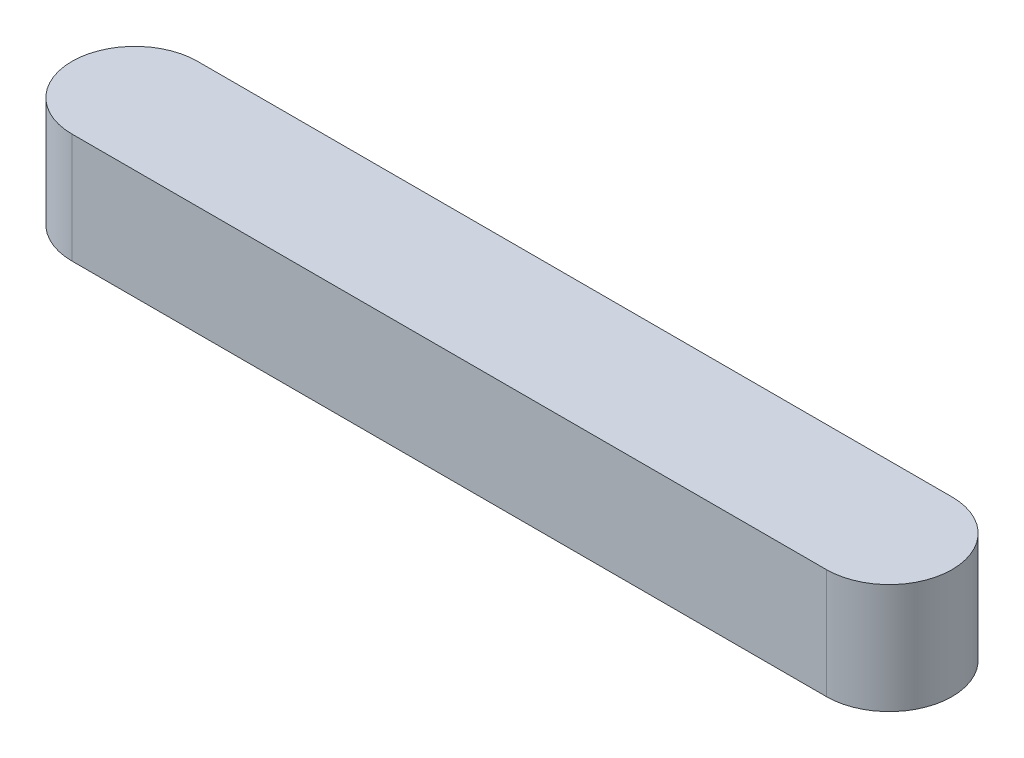
from build123d import *

# Parameters (mm, degrees)
EXTRUDE_1_DEPTH = 7


with BuildPart() as part:
    # Эскиз1 → Бобышка-Вытянуть1 (new body)
    with BuildSketch(Plane(origin=(0, 0, 0), x_dir=(1, 0, 0), z_dir=(0, 1, 0))):
        with BuildLine():
            Line((0, 4), (48, 4))
            ThreePointArc((48, 4), (52, 0), (48, -4))
            Line((48, -4), (0, -4))
            ThreePointArc((0, -4), (-4, 0), (0, 4))
        make_face()
    extrude(amount=EXTRUDE_1_DEPTH)


solid = part.part
